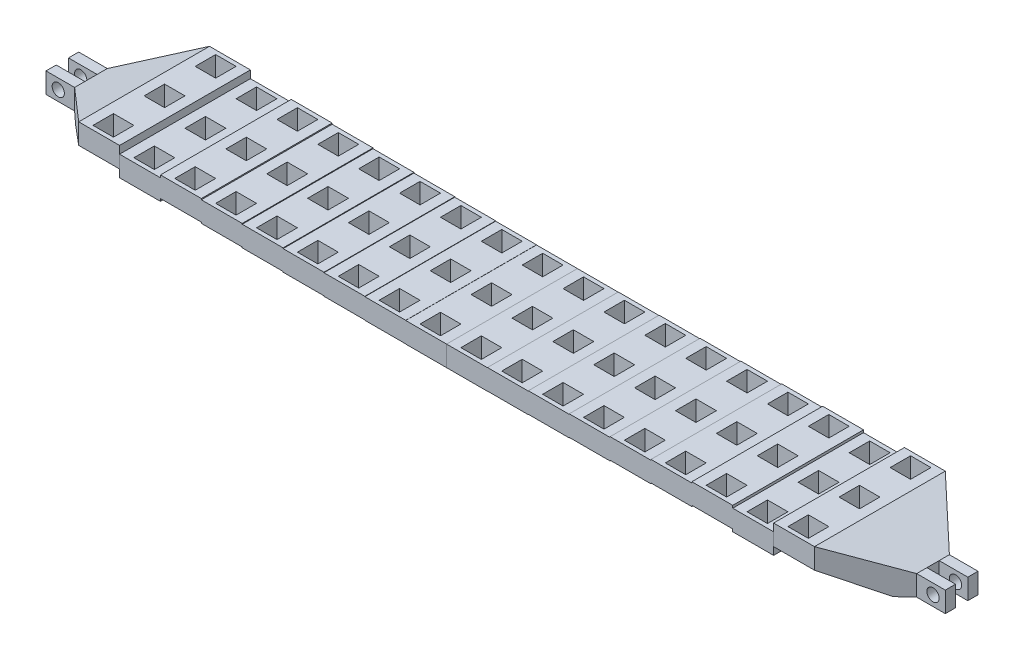
from build123d import *

# Parameters (mm, degrees)
BOSS_EXTRUDE1_DEPTH             = 16
BODY_MOVE_COPY1_ANGLE           = 180
SKETCH2_W                       = 7
SKETCH2_H                       = 3
CUT_EXTRUDE2_DEPTH              = 112.269942033
SKETCH3_W                       = 7
SKETCH3_H                       = 3
CUT_EXTRUDE3_DEPTH              = 112.269942033
SKETCH4_R                       = 1.5
CUT_EXTRUDE4_DEPTH              = 112.915146428
SKETCH5_R                       = 1.5
CUT_EXTRUDE5_DEPTH              = 112.915146428
SKETCH8_W                       = 10
SKETCH8_H                       = 5
BOSS_EXTRUDE2_DEPTH             = 16
BOSS_EXTRUDE2_2_DEPTH           = 16
BOSS_EXTRUDE2_3_DEPTH           = 16
BOSS_EXTRUDE2_4_DEPTH           = 16
BOSS_EXTRUDE2_5_DEPTH           = 16
SKETCH9_W                       = 10
SKETCH9_H                       = 5
BOSS_EXTRUDE3_DEPTH             = 16
BODY_MOVE_COPY3_ANGLE           = 180
BODY_MOVE_COPY3_2_ANGLE         = 180
BODY_MOVE_COPY3_3_ANGLE         = 180
CUT_EXTRUDE7_DEPTH              = 112.279576293
CUT_EXTRUDE7_DEPTH_BACK         = 112.279576293
SKETCH14_W                      = 5
SKETCH14_H                      = 5
BOSS_EXTRUDE4_REACH             = 113.28
BOSS_EXTRUDE4_DIRECTION_2_REACH = 113.28
BOSS_EXTRUDE5_REACH             = 113.28
BOSS_EXTRUDE5_DIRECTION_2_REACH = 113.28
CUT_EXTRUDE9_DEPTH              = 112.279576293
CUT_EXTRUDE9_DEPTH_BACK         = 112.279576293


with BuildPart() as part:
    # Sketch1 → Boss-Extrude1 (new, symmetric)
    with BuildSketch(Plane.XY):
        Polygon((-90, 0), (-90, -5), (-110, -5), (-110, 0), (-104, 0), align=None)
    extrude(amount=BOSS_EXTRUDE1_DEPTH, both=True)


with BuildPart() as body_2:
    # Body-Move/Copy1: copy of part
    add(part.part.rotate(Axis((0, 0, 0), (0, 1, 0)), BODY_MOVE_COPY1_ANGLE))

    # Sketch3 → Cut-Extrude3 (cut, through all)
    with BuildSketch(Plane(origin=(0, 0, 0), x_dir=(1, 0, 0), z_dir=(0, 1, 0))):
        Polygon((110, 4), (110, 16), (90, 16), (103, 4), align=None)
        Polygon((110, -4), (110, -16), (90, -16), (103, -4), align=None)
        with Locations((106.5, 0)):
            Rectangle(SKETCH3_W, SKETCH3_H)
    extrude(amount=-CUT_EXTRUDE3_DEPTH, mode=Mode.SUBTRACT)

    # Sketch5 → Cut-Extrude5 (cut, through all)
    with BuildSketch(Plane.XY.offset(4)):
        with Locations((107, -2.5)):
            Circle(SKETCH5_R)
    extrude(amount=-CUT_EXTRUDE5_DEPTH, mode=Mode.SUBTRACT)



with BuildPart() as part_1:
    add(part.part)

    # Sketch2 → Cut-Extrude2 (cut, through all)
    with BuildSketch(Plane(origin=(0, 0, 0), x_dir=(1, 0, 0), z_dir=(0, 1, 0))):
        Polygon((-110, 16), (-110, 4), (-103, 4), (-90, 16), align=None)
        Polygon((-110, -16), (-110, -4), (-103, -4), (-90, -16), align=None)
        with Locations((-106.5, 0)):
            Rectangle(SKETCH2_W, SKETCH2_H)
    extrude(amount=-CUT_EXTRUDE2_DEPTH, mode=Mode.SUBTRACT)

    # Sketch4 → Cut-Extrude4 (cut, through all)
    with BuildSketch(Plane.XY.offset(4)):
        with Locations((-107, -2.5)):
            Circle(SKETCH4_R)
        with Locations((107.5, 2.5)):
            Circle(SKETCH4_R)
    extrude(amount=-CUT_EXTRUDE4_DEPTH, mode=Mode.SUBTRACT)


with BuildPart() as body_3:
    # Sketch8 → Boss-Extrude2 (new, symmetric)
    with BuildSketch(Plane.XY):
        with Locations((-85, 2.71)):
            Rectangle(SKETCH8_W, SKETCH8_H)
    extrude(amount=BOSS_EXTRUDE2_DEPTH, both=True)


with BuildPart() as body_4:
    # Sketch8 → Boss-Extrude2 2 (new, symmetric)
    with BuildSketch(Plane.XY):
        with Locations((-65, 1.46)):
            Rectangle(SKETCH8_W, SKETCH8_H)
    extrude(amount=BOSS_EXTRUDE2_2_DEPTH, both=True)



with BuildPart() as body_5:
    # Sketch8 → Boss-Extrude2 3 (new, symmetric)
    with BuildSketch(Plane.XY):
        with Locations((-45, 1.01)):
            Rectangle(SKETCH8_W, SKETCH8_H)
    extrude(amount=BOSS_EXTRUDE2_3_DEPTH, both=True)


with BuildPart() as body_6:
    # Sketch8 → Boss-Extrude2 4 (new, symmetric)
    with BuildSketch(Plane.XY):
        with Locations((-25, 0.74)):
            Rectangle(SKETCH8_W, SKETCH8_H)
    extrude(amount=BOSS_EXTRUDE2_4_DEPTH, both=True)


with BuildPart() as body_7:
    # Sketch8 → Boss-Extrude2 5 (new, symmetric)
    with BuildSketch(Plane.XY):
        with Locations((-5, 0.62)):
            Rectangle(SKETCH8_W, SKETCH8_H)
    extrude(amount=BOSS_EXTRUDE2_5_DEPTH, both=True)


with BuildPart() as body_4_1:
    add(body_4.part)

    add(body_5.part)  # Boss-Extrude3 merges body 5

    add(body_6.part)  # Boss-Extrude3 merges body 6

    add(body_7.part)  # Boss-Extrude3 merges body 7
    # Sketch9 → Boss-Extrude3 (add, symmetric)
    with BuildSketch(Plane.XY):
        with Locations((-75, 0.85)):
            Rectangle(SKETCH9_W, SKETCH9_H)
        with Locations((-55, 1.19)):
            Rectangle(SKETCH9_W, SKETCH9_H)
        with Locations((-35, 0.85)):
            Rectangle(SKETCH9_W, SKETCH9_H)
        with Locations((-15, 0.66)):
            Rectangle(SKETCH9_W, SKETCH9_H)
    extrude(amount=BOSS_EXTRUDE3_DEPTH, both=True)


with BuildPart() as body_5_2:
    # Body-Move/Copy3: read off the stored shape, not the designer's step
    # Body-Move/Copy3: copy of body 4
    add(body_4_1.part.rotate(Axis((0, 0, 0), (0, 1, 0)), BODY_MOVE_COPY3_ANGLE))


with BuildPart() as body_6_2:
    # Body-Move_Copy3 2: copy of body 3
    add(body_3.part.rotate(Axis((0, 0, 0), (0, 1, 0)), BODY_MOVE_COPY3_2_ANGLE))


with BuildPart() as body_7_2:
    # Body-Move_Copy3 3: copy of part
    add(part_1.part.rotate(Axis((0, 0, 0), (0, 1, 0)), BODY_MOVE_COPY3_3_ANGLE))


with BuildPart() as cut_extrude7_tool:
    # Sketch14 → Cut-Extrude7 (new, two sides: drawn at the far end of the back side and taken through both)
    with BuildSketch(Plane(origin=(0, 0, 0), x_dir=(1, 0, 0), z_dir=(0, 1, 0)).offset(-CUT_EXTRUDE7_DEPTH_BACK)):
        with Locations((-75, -12.5)):
            Rectangle(SKETCH14_W, SKETCH14_H)
        with Locations((-85, -12.5)):
            Rectangle(SKETCH14_W, SKETCH14_H)
        with Locations((-65, -12.5)):
            Rectangle(SKETCH14_W, SKETCH14_H)
        with Locations((-55, -12.5)):
            Rectangle(SKETCH14_W, SKETCH14_H)
        with Locations((-45, -12.5)):
            Rectangle(SKETCH14_W, SKETCH14_H)
        with Locations((-35, -12.5)):
            Rectangle(SKETCH14_W, SKETCH14_H)
        with Locations((-25, -12.5)):
            Rectangle(SKETCH14_W, SKETCH14_H)
        with Locations((-15, -12.5)):
            Rectangle(SKETCH14_W, SKETCH14_H)
        with Locations((-5, -12.5)):
            Rectangle(SKETCH14_W, SKETCH14_H)
        with Locations((5, -12.5)):
            Rectangle(SKETCH14_W, SKETCH14_H)
        with Locations((15, -12.5)):
            Rectangle(SKETCH14_W, SKETCH14_H)
        with Locations((25, -12.5)):
            Rectangle(SKETCH14_W, SKETCH14_H)
        with Locations((35, -12.5)):
            Rectangle(SKETCH14_W, SKETCH14_H)
        with Locations((45, -12.5)):
            Rectangle(SKETCH14_W, SKETCH14_H)
        with Locations((55, -12.5)):
            Rectangle(SKETCH14_W, SKETCH14_H)
        with Locations((65, -12.5)):
            Rectangle(SKETCH14_W, SKETCH14_H)
        with Locations((75, -12.5)):
            Rectangle(SKETCH14_W, SKETCH14_H)
        with Locations((85, -12.5)):
            Rectangle(SKETCH14_W, SKETCH14_H)
        with Locations((-75, 0)):
            Rectangle(SKETCH14_W, SKETCH14_H)
        with Locations((-65, 0)):
            Rectangle(SKETCH14_W, SKETCH14_H)
        with Locations((-55, 0)):
            Rectangle(SKETCH14_W, SKETCH14_H)
        with Locations((-45, 0)):
            Rectangle(SKETCH14_W, SKETCH14_H)
        with Locations((-35, 0)):
            Rectangle(SKETCH14_W, SKETCH14_H)
        with Locations((-25, 0)):
            Rectangle(SKETCH14_W, SKETCH14_H)
        with Locations((-15, 0)):
            Rectangle(SKETCH14_W, SKETCH14_H)
        with Locations((-5, 0)):
            Rectangle(SKETCH14_W, SKETCH14_H)
        with Locations((5, 0)):
            Rectangle(SKETCH14_W, SKETCH14_H)
        with Locations((15, 0)):
            Rectangle(SKETCH14_W, SKETCH14_H)
        with Locations((25, 0)):
            Rectangle(SKETCH14_W, SKETCH14_H)
        with Locations((35, 0)):
            Rectangle(SKETCH14_W, SKETCH14_H)
        with Locations((45, 0)):
            Rectangle(SKETCH14_W, SKETCH14_H)
        with Locations((55, 0)):
            Rectangle(SKETCH14_W, SKETCH14_H)
        with Locations((65, 0)):
            Rectangle(SKETCH14_W, SKETCH14_H)
        with Locations((75, 0)):
            Rectangle(SKETCH14_W, SKETCH14_H)
        with Locations((85, 0)):
            Rectangle(SKETCH14_W, SKETCH14_H)
        with Locations((-75, 12.5)):
            Rectangle(SKETCH14_W, SKETCH14_H)
        with Locations((-65, 12.5)):
            Rectangle(SKETCH14_W, SKETCH14_H)
        with Locations((-55, 12.5)):
            Rectangle(SKETCH14_W, SKETCH14_H)
        with Locations((-45, 12.5)):
            Rectangle(SKETCH14_W, SKETCH14_H)
        with Locations((-35, 12.5)):
            Rectangle(SKETCH14_W, SKETCH14_H)
        with Locations((-25, 12.5)):
            Rectangle(SKETCH14_W, SKETCH14_H)
        with Locations((-15, 12.5)):
            Rectangle(SKETCH14_W, SKETCH14_H)
        with Locations((-5, 12.5)):
            Rectangle(SKETCH14_W, SKETCH14_H)
        with Locations((5, 12.5)):
            Rectangle(SKETCH14_W, SKETCH14_H)
        with Locations((15, 12.5)):
            Rectangle(SKETCH14_W, SKETCH14_H)
        with Locations((25, 12.5)):
            Rectangle(SKETCH14_W, SKETCH14_H)
        with Locations((35, 12.5)):
            Rectangle(SKETCH14_W, SKETCH14_H)
        with Locations((45, 12.5)):
            Rectangle(SKETCH14_W, SKETCH14_H)
        with Locations((55, 12.5)):
            Rectangle(SKETCH14_W, SKETCH14_H)
        with Locations((65, 12.5)):
            Rectangle(SKETCH14_W, SKETCH14_H)
        with Locations((75, 12.5)):
            Rectangle(SKETCH14_W, SKETCH14_H)
        with Locations((85, 12.5)):
            Rectangle(SKETCH14_W, SKETCH14_H)
        with Locations((-85, 0)):
            Rectangle(SKETCH14_W, SKETCH14_H)
        with Locations((-85, 12.5)):
            Rectangle(SKETCH14_W, SKETCH14_H)
    extrude(amount=CUT_EXTRUDE7_DEPTH + CUT_EXTRUDE7_DEPTH_BACK)


with BuildPart() as body_3_1:
    add(body_3.part)

    # Cut-Extrude7: cut by cut_extrude7_tool
    add(cut_extrude7_tool.part, mode=Mode.SUBTRACT)


with BuildPart() as body_4_2:
    add(body_4_1.part)

    # Cut-Extrude7: cut by cut_extrude7_tool
    add(cut_extrude7_tool.part, mode=Mode.SUBTRACT)


with BuildPart() as body_5_2_1:
    add(body_5_2.part)

    # Cut-Extrude7: cut by cut_extrude7_tool
    add(cut_extrude7_tool.part, mode=Mode.SUBTRACT)


with BuildPart() as body_6_2_1:
    add(body_6_2.part)

    # Cut-Extrude7: cut by cut_extrude7_tool
    add(cut_extrude7_tool.part, mode=Mode.SUBTRACT)


with BuildPart() as part_2:
    add(part_1.part)

    add(body_3_1.part)  # Boss-Extrude4 merges body 3
    # Boss-Extrude4: up to this plane
    boss_extrude4_end = Plane(origin=(-103, -5, 4), z_dir=(0.6782801027330659, 0, -0.7348034446274879))
    # Sketch15 → Boss-Extrude4 (add, up to the surface)
    with BuildSketch(Plane.XY, mode=Mode.PRIVATE) as boss_extrude4_sk1:
        Polygon((-103, 0), (-90, 5.21), (-90, 0), align=None)
    boss_extrude4_tool1 = split(extrude(boss_extrude4_sk1.sketch, amount=BOSS_EXTRUDE4_REACH, mode=Mode.PRIVATE), bisect_by=boss_extrude4_end, keep=Keep.BOTH, mode=Mode.PRIVATE)
    add(boss_extrude4_tool1.solids().sort_by_distance((-94.333333, 1.736667, 0))[0])

    # Boss-Extrude4 direction 2: up to this plane
    boss_extrude4_direction_2_end = Plane(origin=(-90, -5, -16), z_dir=(0.678280102733066, 0, 0.7348034446274877))
    # Sketch15 → Boss-Extrude4 direction 2 (add, up to the surface)
    with BuildSketch(Plane.XY, mode=Mode.PRIVATE) as boss_extrude4_direction_2_sk1:
        Polygon((-103, 0), (-90, 5.21), (-90, 0), align=None)
    boss_extrude4_direction_2_tool1 = split(extrude(boss_extrude4_direction_2_sk1.sketch, amount=-BOSS_EXTRUDE4_DIRECTION_2_REACH, mode=Mode.PRIVATE), bisect_by=boss_extrude4_direction_2_end, keep=Keep.BOTH, mode=Mode.PRIVATE)
    add(boss_extrude4_direction_2_tool1.solids().sort_by_distance((-94.333333, 1.736667, 0))[0])


with BuildPart() as body_2_1:
    add(body_2.part)

    add(body_6_2_1.part)  # Boss-Extrude5 merges body 6 2

    add(body_7_2.part)  # Boss-Extrude5 merges body 7 2
    # Boss-Extrude5: up to this plane
    boss_extrude5_end = Plane(origin=(90, -5, 16), z_dir=(-0.6782801027330855, 0, -0.7348034446274697))
    # Sketch16 → Boss-Extrude5 (add, up to the surface)
    with BuildSketch(Plane.XY, mode=Mode.PRIVATE) as boss_extrude5_sk1:
        Polygon((90, 5.21), (103, 0), (90, 0), align=None)
    boss_extrude5_tool1 = split(extrude(boss_extrude5_sk1.sketch, amount=BOSS_EXTRUDE5_REACH, mode=Mode.PRIVATE), bisect_by=boss_extrude5_end, keep=Keep.BOTH, mode=Mode.PRIVATE)
    add(boss_extrude5_tool1.solids().sort_by_distance((94.333333, 1.736667, 0))[0])

    # Boss-Extrude5 direction 2: up to this plane
    boss_extrude5_direction_2_end = Plane(origin=(90, -5, -16), z_dir=(-0.6782801027330659, 0, 0.7348034446274879))
    # Sketch16 → Boss-Extrude5 direction 2 (add, up to the surface)
    with BuildSketch(Plane.XY, mode=Mode.PRIVATE) as boss_extrude5_direction_2_sk1:
        Polygon((90, 5.21), (103, 0), (90, 0), align=None)
    boss_extrude5_direction_2_tool1 = split(extrude(boss_extrude5_direction_2_sk1.sketch, amount=-BOSS_EXTRUDE5_DIRECTION_2_REACH, mode=Mode.PRIVATE), bisect_by=boss_extrude5_direction_2_end, keep=Keep.BOTH, mode=Mode.PRIVATE)
    add(boss_extrude5_direction_2_tool1.solids().sort_by_distance((94.333333, 1.736667, 0))[0])


with BuildPart() as cut_extrude9_tool:
    # Sketch17 → Cut-Extrude9 (new, two sides: drawn at the far end of the back side and taken through both)
    with BuildSketch(Plane.XY.offset(-CUT_EXTRUDE9_DEPTH_BACK)):
        Polygon((-100, -5), (-90, 0.21), (-90, -5), align=None)
        Polygon((100, -5), (90, 0.21), (90, -5), align=None)
    extrude(amount=CUT_EXTRUDE9_DEPTH + CUT_EXTRUDE9_DEPTH_BACK)


with BuildPart() as part_3:
    add(part_2.part)

    # Cut-Extrude9: cut by cut_extrude9_tool
    add(cut_extrude9_tool.part, mode=Mode.SUBTRACT)


with BuildPart() as body_2_2:
    add(body_2_1.part)

    # Cut-Extrude9: cut by cut_extrude9_tool
    add(cut_extrude9_tool.part, mode=Mode.SUBTRACT)


solid = Compound([body_4_2.part, body_5_2_1.part, part_3.part, body_2_2.part])
